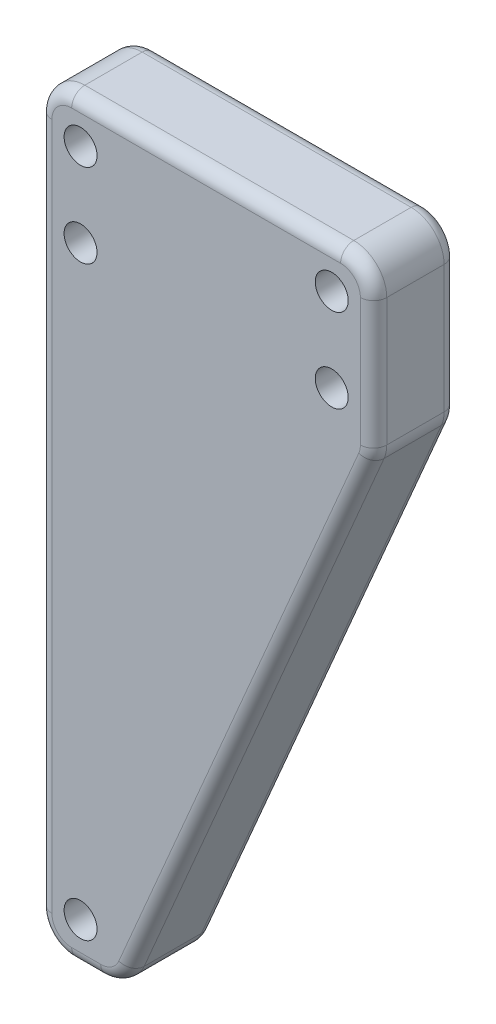
from build123d import *

# Parameters (mm, degrees)
SKETCH1_R           = 2.5
BOSS_EXTRUDE1_DEPTH = 12.7
CUT_EXTRUDE1_START  = -12.7
CUT_EXTRUDE1_DEPTH  = 4.5
FILLET1_R           = 5
FILLET2_R           = 2


with BuildPart() as part:
    # Sketch1 → Boss-Extrude1 (new body)
    with BuildSketch(Plane.XY):
        Polygon((0, 0), (0, -114.3), (12.7, -114.3), (50.8, -25.4), (50.8, 0), align=None)
        with Locations((6.35, -6.35)):
            Circle(SKETCH1_R, mode=Mode.SUBTRACT)
        with Locations((6.35, -107.95)):
            Circle(SKETCH1_R, mode=Mode.SUBTRACT)
        with Locations((44.45, -6.35)):
            Circle(SKETCH1_R, mode=Mode.SUBTRACT)
        with Locations((44.45, -19.05)):
            Circle(SKETCH1_R, mode=Mode.SUBTRACT)
        with Locations((6.35, -19.05)):
            Circle(SKETCH1_R, mode=Mode.SUBTRACT)
    extrude(amount=BOSS_EXTRUDE1_DEPTH)

    # Sketch2 → Cut-Extrude1 (cut)
    with BuildSketch(Plane.XY.offset(12.7).offset(CUT_EXTRUDE1_START)):
        Polygon((6.35, -113.001814855), (10.725, -110.475907428), (10.725, -105.424092572), (6.35, -102.898185145), (1.975, -105.424092572), (1.975, -110.475907428), align=None)
    extrude(amount=CUT_EXTRUDE1_DEPTH, mode=Mode.SUBTRACT)

    # Fillet1
    fillet1_edges = [part.edges().sort_by_distance(p)[0] for p in [
        (50.8, 0, 6.35),
        (50.8, -25.4, 6.35),
        (12.7, -114.3, 6.35),
        (0, -114.3, 6.35),
        (0, 0, 6.35),
    ]]
    fillet(fillet1_edges, radius=FILLET1_R)

    # Fillet2
    # the kernel refuses this fillet: 2 mm, written as the material it takes off along each edge
    with BuildSketch(Plane(origin=(45.8, -24.37371149, 12.7), x_dir=(1, 0, 0), z_dir=(0, 1, 0))) as fillet2_piece_1:
        with BuildLine():
            CenterArc((5 - FILLET2_R, FILLET2_R), FILLET2_R, 270, 90)
            Line((5, FILLET2_R), (5, 0))
            Line((5, 0), (5 - FILLET2_R, 0))
        make_face()
    fillet2_piece_1_solid = revolve(axis=Axis((45.8, -24.37371149, 12.7), (0, 0, -1)), revolution_arc=23.198590514, mode=Mode.PRIVATE)
    with BuildSketch(Plane(origin=(13.99874436, -111.269596493, 12.7), x_dir=(-0.9191450300180581, 0.3939192985791675, 0), z_dir=(0.39391929857916747, 0.919145030018058, 0))) as fillet2_piece_2:
        with BuildLine():
            CenterArc((FILLET2_R, -FILLET2_R), FILLET2_R, 90, 90)
            Line((0, -FILLET2_R), (0, 0))
            Line((0, 0), (FILLET2_R, 0))
        make_face()
    fillet2_piece_2_solid = extrude(amount=92.397049145, mode=Mode.PRIVATE)
    with BuildSketch(Plane(origin=(9.40301921, -109.3, 12.7), x_dir=(0, -1, 0), z_dir=(-1, 0, 0))) as fillet2_piece_3:
        with BuildLine():
            CenterArc((5 - FILLET2_R, -FILLET2_R), FILLET2_R, 0, 90)
            Line((5, -FILLET2_R), (5, 0))
            Line((5, 0), (5 - FILLET2_R, 0))
        make_face()
    fillet2_piece_3_solid = revolve(axis=Axis((9.40301921, -109.3, 12.7), (0, 0, 1)), revolution_arc=66.801409486, mode=Mode.PRIVATE)
    with BuildSketch(Plane(origin=(5, -114.3, 12.7), x_dir=(0, 1, 0), z_dir=(1, 0, 0))) as fillet2_piece_4:
        with BuildLine():
            CenterArc((FILLET2_R, -FILLET2_R), FILLET2_R, 90, 90)
            Line((0, -FILLET2_R), (0, 0))
            Line((0, 0), (FILLET2_R, 0))
        make_face()
    fillet2_piece_4_solid = extrude(amount=4.40301921, mode=Mode.PRIVATE)
    with BuildSketch(Plane(origin=(5, -109.3, 12.7), x_dir=(-1, 0, 0), z_dir=(0, 1, 0))) as fillet2_piece_5:
        with BuildLine():
            CenterArc((5 - FILLET2_R, -FILLET2_R), FILLET2_R, 0, 90)
            Line((5 - FILLET2_R, 0), (5, 0))
            Line((5, 0), (5, -FILLET2_R))
        make_face()
    fillet2_piece_5_solid = revolve(axis=Axis((5, -109.3, 12.7), (0, 0, 1)), revolution_arc=90, mode=Mode.PRIVATE)
    with BuildSketch(Plane(origin=(0, -5, 12.7), x_dir=(0, 0, -1), z_dir=(0, -1, 0))) as fillet2_piece_6:
        with BuildLine():
            CenterArc((FILLET2_R, FILLET2_R), FILLET2_R, 180, 90)
            Line((0, FILLET2_R), (0, 0))
            Line((0, 0), (FILLET2_R, 0))
        make_face()
    fillet2_piece_6_solid = extrude(amount=104.3, mode=Mode.PRIVATE)
    with BuildSketch(Plane(origin=(5, -5, 12.7), x_dir=(-1, 0, 0), z_dir=(0, -1, 0))) as fillet2_piece_7:
        with BuildLine():
            CenterArc((5 - FILLET2_R, FILLET2_R), FILLET2_R, 270, 90)
            Line((5 - FILLET2_R, 0), (5, 0))
            Line((5, 0), (5, FILLET2_R))
        make_face()
    fillet2_piece_7_solid = revolve(axis=Axis((5, -5, 12.7), (0, 0, -1)), revolution_arc=90, mode=Mode.PRIVATE)
    with BuildSketch(Plane(origin=(45.8, 0, 12.7), x_dir=(0, -1, 0), z_dir=(-1, 0, 0))) as fillet2_piece_8:
        with BuildLine():
            CenterArc((FILLET2_R, -FILLET2_R), FILLET2_R, 90, 90)
            Line((0, -FILLET2_R), (0, 0))
            Line((0, 0), (FILLET2_R, 0))
        make_face()
    fillet2_piece_8_solid = extrude(amount=40.8, mode=Mode.PRIVATE)
    with BuildSketch(Plane(origin=(45.8, -5, 12.7), x_dir=(0, 1, 0), z_dir=(-1, 0, 0))) as fillet2_piece_9:
        with BuildLine():
            CenterArc((5 - FILLET2_R, FILLET2_R), FILLET2_R, 270, 90)
            Line((5, FILLET2_R), (5, 0))
            Line((5, 0), (5 - FILLET2_R, 0))
        make_face()
    fillet2_piece_9_solid = revolve(axis=Axis((45.8, -5, 12.7), (0, 0, -1)), revolution_arc=90, mode=Mode.PRIVATE)
    with BuildSketch(Plane(origin=(9.40301921, -109.3, 0), x_dir=(0, -1, 0), z_dir=(-1, 0, 0))) as fillet2_piece_10:
        with BuildLine():
            CenterArc((5 - FILLET2_R, FILLET2_R), FILLET2_R, 270, 90)
            Line((5, FILLET2_R), (5, 0))
            Line((5, 0), (5 - FILLET2_R, 0))
        make_face()
    fillet2_piece_10_solid = revolve(axis=Axis((9.40301921, -109.3, 0), (0, 0, 1)), revolution_arc=66.801409486, mode=Mode.PRIVATE)
    with BuildSketch(Plane(origin=(5, -114.3, 0), x_dir=(0, 1, 0), z_dir=(1, 0, 0))) as fillet2_piece_11:
        with BuildLine():
            CenterArc((FILLET2_R, FILLET2_R), FILLET2_R, 180, 90)
            Line((0, FILLET2_R), (0, 0))
            Line((0, 0), (FILLET2_R, 0))
        make_face()
    fillet2_piece_11_solid = extrude(amount=4.40301921, mode=Mode.PRIVATE)
    with BuildSketch(Plane(origin=(5, -109.3, 0), x_dir=(-1, 0, 0), z_dir=(0, 1, 0))) as fillet2_piece_12:
        with BuildLine():
            CenterArc((5 - FILLET2_R, FILLET2_R), FILLET2_R, 270, 90)
            Line((5, FILLET2_R), (5, 0))
            Line((5, 0), (5 - FILLET2_R, 0))
        make_face()
    fillet2_piece_12_solid = revolve(axis=Axis((5, -109.3, 0), (0, 0, 1)), revolution_arc=90, mode=Mode.PRIVATE)
    with BuildSketch(Plane(origin=(0, -5, 0), x_dir=(0, 0, 1), z_dir=(0, -1, 0))) as fillet2_piece_13:
        with BuildLine():
            CenterArc((FILLET2_R, -FILLET2_R), FILLET2_R, 90, 90)
            Line((0, -FILLET2_R), (0, 0))
            Line((0, 0), (FILLET2_R, 0))
        make_face()
    fillet2_piece_13_solid = extrude(amount=104.3, mode=Mode.PRIVATE)
    with BuildSketch(Plane(origin=(5, -5, 0), x_dir=(-1, 0, 0), z_dir=(0, -1, 0))) as fillet2_piece_14:
        with BuildLine():
            CenterArc((5 - FILLET2_R, -FILLET2_R), FILLET2_R, 0, 90)
            Line((5, -FILLET2_R), (5, 0))
            Line((5, 0), (5 - FILLET2_R, 0))
        make_face()
    fillet2_piece_14_solid = revolve(axis=Axis((5, -5, 0), (0, 0, -1)), revolution_arc=90, mode=Mode.PRIVATE)
    with BuildSketch(Plane(origin=(45.8, 0, 0), x_dir=(0, -1, 0), z_dir=(-1, 0, 0))) as fillet2_piece_15:
        with BuildLine():
            CenterArc((FILLET2_R, FILLET2_R), FILLET2_R, 180, 90)
            Line((0, FILLET2_R), (0, 0))
            Line((0, 0), (FILLET2_R, 0))
        make_face()
    fillet2_piece_15_solid = extrude(amount=40.8, mode=Mode.PRIVATE)
    with BuildSketch(Plane(origin=(45.8, -5, 0), x_dir=(0, 1, 0), z_dir=(-1, 0, 0))) as fillet2_piece_16:
        with BuildLine():
            CenterArc((5 - FILLET2_R, -FILLET2_R), FILLET2_R, 0, 90)
            Line((5, -FILLET2_R), (5, 0))
            Line((5, 0), (5 - FILLET2_R, 0))
        make_face()
    fillet2_piece_16_solid = revolve(axis=Axis((45.8, -5, 0), (0, 0, -1)), revolution_arc=90, mode=Mode.PRIVATE)
    with BuildSketch(Plane(origin=(50.8, -24.37371149, 0), x_dir=(-1, 0, 0), z_dir=(0, 1, 0))) as fillet2_piece_17:
        with BuildLine():
            CenterArc((FILLET2_R, FILLET2_R), FILLET2_R, 180, 90)
            Line((0, FILLET2_R), (0, 0))
            Line((0, 0), (FILLET2_R, 0))
        make_face()
    fillet2_piece_17_solid = extrude(amount=19.37371149, mode=Mode.PRIVATE)
    with BuildSketch(Plane(origin=(45.8, -24.37371149, 0), x_dir=(1, 0, 0), z_dir=(0, 1, 0))) as fillet2_piece_18:
        with BuildLine():
            CenterArc((5 - FILLET2_R, -FILLET2_R), FILLET2_R, 0, 90)
            Line((5, -FILLET2_R), (5, 0))
            Line((5, 0), (5 - FILLET2_R, 0))
        make_face()
    fillet2_piece_18_solid = revolve(axis=Axis((45.8, -24.37371149, 0), (0, 0, -1)), revolution_arc=23.198590514, mode=Mode.PRIVATE)
    with BuildSketch(Plane(origin=(50.8, -24.37371149, 12.7), x_dir=(-1, 0, 0), z_dir=(0, 1, 0))) as fillet2_piece_19:
        with BuildLine():
            CenterArc((FILLET2_R, -FILLET2_R), FILLET2_R, 90, 90)
            Line((0, -FILLET2_R), (0, 0))
            Line((0, 0), (FILLET2_R, 0))
        make_face()
    fillet2_piece_19_solid = extrude(amount=19.37371149, mode=Mode.PRIVATE)
    with BuildSketch(Plane(origin=(13.99874436, -111.269596493, 0), x_dir=(-0.9191450300180581, 0.3939192985791675, 0), z_dir=(0.39391929857916747, 0.919145030018058, 0))) as fillet2_piece_20:
        with BuildLine():
            CenterArc((FILLET2_R, FILLET2_R), FILLET2_R, 180, 90)
            Line((0, FILLET2_R), (0, 0))
            Line((0, 0), (FILLET2_R, 0))
        make_face()
    fillet2_piece_20_solid = extrude(amount=92.397049145, mode=Mode.PRIVATE)
    add([fillet2_piece_1_solid, fillet2_piece_2_solid, fillet2_piece_3_solid, fillet2_piece_4_solid, fillet2_piece_5_solid, fillet2_piece_6_solid, fillet2_piece_7_solid, fillet2_piece_8_solid, fillet2_piece_9_solid, fillet2_piece_10_solid, fillet2_piece_11_solid, fillet2_piece_12_solid, fillet2_piece_13_solid, fillet2_piece_14_solid, fillet2_piece_15_solid, fillet2_piece_16_solid, fillet2_piece_17_solid, fillet2_piece_18_solid, fillet2_piece_19_solid, fillet2_piece_20_solid], mode=Mode.SUBTRACT)


solid = part.part
